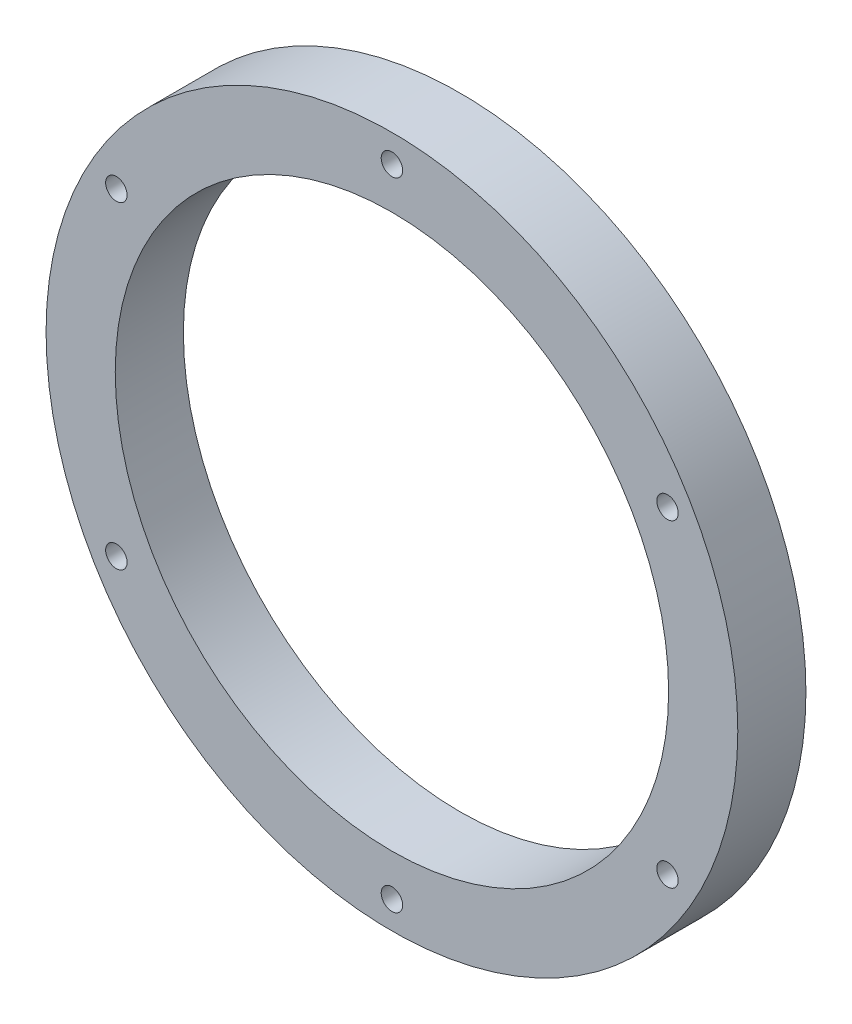
from build123d import *

# Parameters (mm, degrees)
SKIZZE1_R                        = 50
SKIZZE1_R_2                      = 40
AUFSATZ_LINEAR_AUSTRAGEN1_DEPTH  = 9.85
F_3_1_3_1_DURCHMESSER_BOHRUNG1_D = 3.1


with BuildPart() as part:
    # Skizze1 → Aufsatz-Linear austragen1 (new body)
    with BuildSketch(Plane.XY):
        Circle(SKIZZE1_R)
        Circle(SKIZZE1_R_2, mode=Mode.SUBTRACT)
    extrude(amount=AUFSATZ_LINEAR_AUSTRAGEN1_DEPTH)

    # Ø3.1 (3.1) Durchmesser Bohrung1 (through all)
    with Locations(Plane.XY.offset(9.85)):
        with Locations((-39.837168574, 23), (0, 46), (39.837168574, 23), (39.837168574, -23), (0, -46), (-39.837168574, -23)):
            Hole(F_3_1_3_1_DURCHMESSER_BOHRUNG1_D / 2)


solid = part.part
